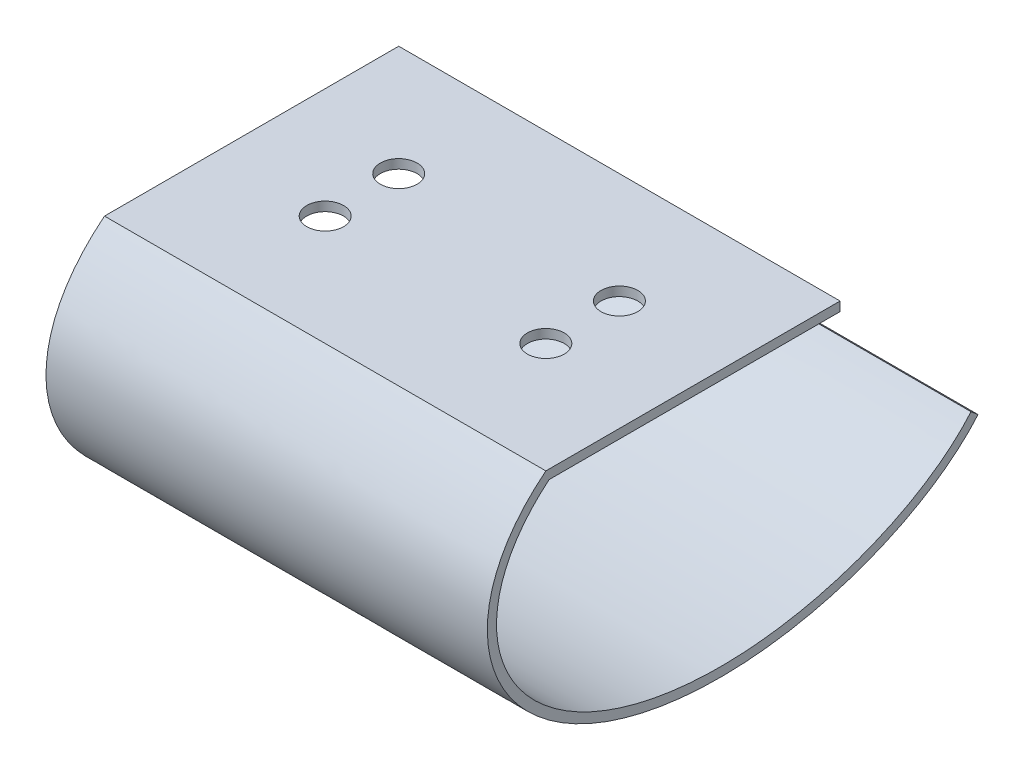
from build123d import *

# Parameters (mm, degrees)
BOSS_EXTRUDE2_DEPTH = 76.2
SKETCH4_R           = 3.175
CUT_EXTRUDE1_DEPTH  = 25.4


# Read off the part's stored shape, not the designer's step: Boss-Extrude2
with BuildPart() as part:
    # Boss-Extrude2 outline → Boss-Extrude2 (new body)
    with BuildSketch(Plane(origin=(0, 0, 0), x_dir=(0, 0, -1), z_dir=(1, 0, 0))):
        with BuildLine():
            Line((50.8, 0), (0, 0))
            add(Edge.make_bspline(
                [(0, 0), (-23.093868685, -18.455260894), (-10.1595442, -47.097742579), (21.473331951, -55.825894818), (60.12968581, -45.98254215), (74.612224677, -28.877219623)],
                knots=[0, 0, 0, 0, 0, 0, 1, 1, 1, 1, 1, 1], degree=5))
            Line((74.612224677, -28.877219623), (73.400656511, -27.851422943))
            add(Edge.make_bspline(
                [(73.400656511, -27.851422943), (73.040808721, -28.276439066), (72.303030346, -29.093361117), (70.65626187, -30.716019497), (68.342434421, -32.655162364), (65.194689539, -34.82976825), (60.578087813, -37.488101748), (54.146349457, -40.309453372), (45.757464722, -42.760644317), (37.053619061, -44.18423618), (25.46737183, -44.635985744), (11.79636869, -42.408460512), (1.070224576, -36.658794962), (-4.802331787, -30.433881169), (-7.664221751, -25.139005486), (-8.816520125, -19.403513515), (-8.204900671, -14.401846822), (-6.646919896, -10.366246876), (-4.907859633, -7.358601035), (-2.943049119, -4.895392466), (-1.059121191, -2.988787926), (0.019090287, -2.037276651), (0.563538482, -1.5875)],
                knots=[0.003923701, 0.003923701, 0.003923701, 0.003923701, 0.019487394, 0.035051086, 0.06617847, 0.097305854, 0.128433239, 0.190688007, 0.252942776, 0.315197545, 0.377452313, 0.501961851, 0.626471388, 0.688726157, 0.750980925, 0.813235694, 0.875490463, 0.906617847, 0.937745231, 0.968872616, 0.984436308, 1, 1, 1, 1], degree=3))
            Line((0.563538482, -1.5875), (50.8, -1.5875))
            Line((50.8, -1.5875), (50.8, 0))
        make_face()
    extrude(amount=BOSS_EXTRUDE2_DEPTH)

    # Sketch4 → Cut-Extrude1 (cut)
    with BuildSketch(Plane(origin=(0, 0, 0), x_dir=(1, 0, 0), z_dir=(0, 1, 0))):
        with Locations(Location((57.15, 31.75, 0), (0, 0, 270))):
            Circle(SKETCH4_R)
        with Locations(Location((57.15, 19.05, 0), (0, 0, 270))):
            Circle(SKETCH4_R)
        with Locations(Location((19.05, 31.75, 0), (0, 0, 270))):
            Circle(SKETCH4_R)
        with Locations(Location((19.05, 19.05, 0), (0, 0, 270))):
            Circle(SKETCH4_R)
    extrude(amount=-CUT_EXTRUDE1_DEPTH, mode=Mode.SUBTRACT)


solid = part.part
